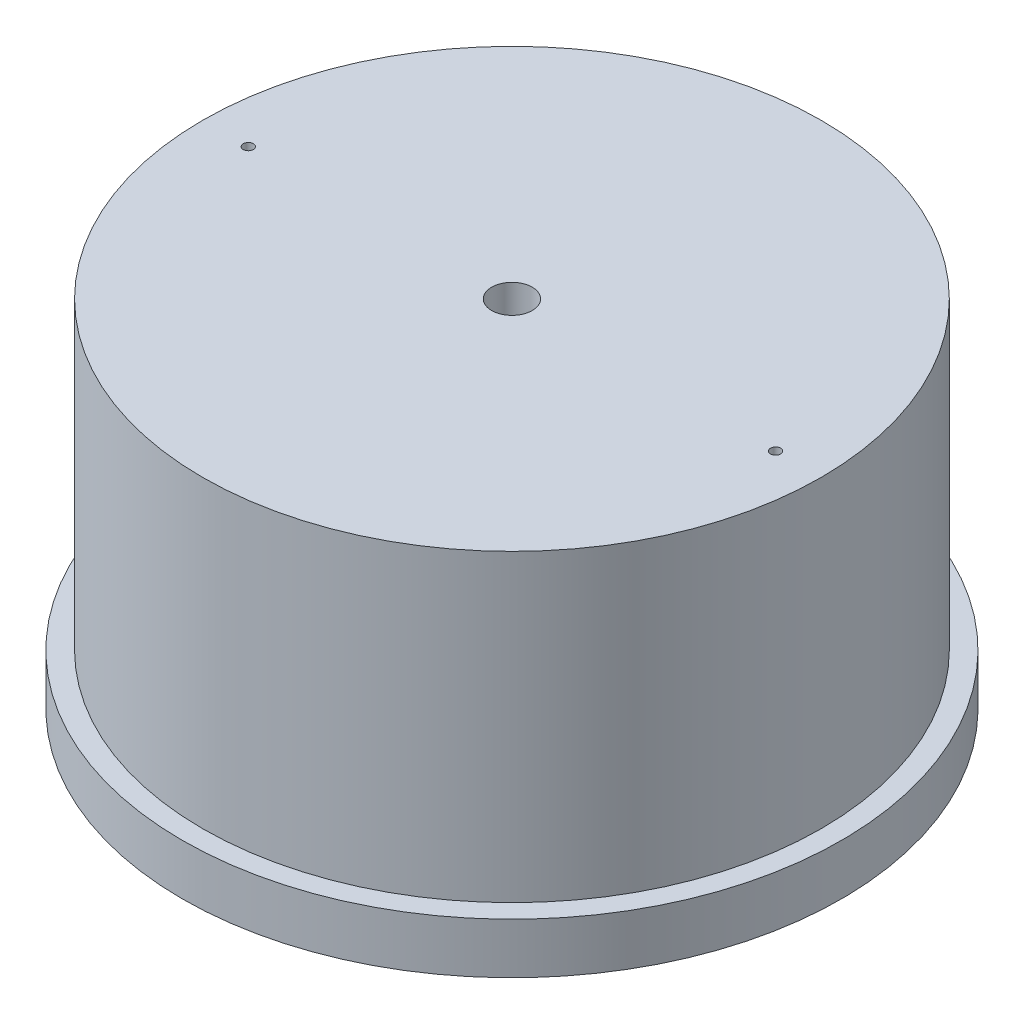
from build123d import *

# Parameters (mm, degrees)
SKETCH1_R           = 32.5
BOSS_EXTRUDE1_DEPTH = 35
CUT_EXTRUDE2_START  = -30
SKETCH2_R           = 32.5
SKETCH2_R_2         = 30.5
CUT_EXTRUDE2_DEPTH  = 30
SKETCH3_R           = 28
SKETCH3_R_2         = 24
CUT_EXTRUDE3_DEPTH  = 25
SKETCH4_R           = 18
CUT_EXTRUDE4_DEPTH  = 20
SKETCH5_R           = 0.5
CUT_EXTRUDE5_DEPTH  = 58.771100041
SKETCH6_R           = 2
CUT_EXTRUDE6_DEPTH  = 58.771100041


with BuildPart() as part:
    # Sketch1 → Boss-Extrude1 (new body)
    with BuildSketch(Plane(origin=(0, 0, 0), x_dir=(1, 0, 0), z_dir=(0, 1, 0))):
        Circle(SKETCH1_R)
    extrude(amount=BOSS_EXTRUDE1_DEPTH)

    # Sketch2 → Cut-Extrude2 (cut)
    with BuildSketch(Plane(origin=(0, 35, 0), x_dir=(1, 0, 0), z_dir=(0, 1, 0)).offset(CUT_EXTRUDE2_START)):
        Circle(SKETCH2_R)
        Circle(SKETCH2_R_2, mode=Mode.SUBTRACT)
    extrude(amount=CUT_EXTRUDE2_DEPTH, mode=Mode.SUBTRACT)

    # Sketch3 → Cut-Extrude3 (cut)
    with BuildSketch(Plane.XZ):
        Circle(SKETCH3_R)
        Circle(SKETCH3_R_2, mode=Mode.SUBTRACT)
    extrude(amount=-CUT_EXTRUDE3_DEPTH, mode=Mode.SUBTRACT)

    # Sketch4 → Cut-Extrude4 (cut)
    with BuildSketch(Plane.XZ):
        Circle(SKETCH4_R)
    extrude(amount=-CUT_EXTRUDE4_DEPTH, mode=Mode.SUBTRACT)

    # Sketch5 → Cut-Extrude5 (cut, through all)
    with BuildSketch(Plane(origin=(0, 35, 0), x_dir=(1, 0, 0), z_dir=(0, 1, 0))):
        with Locations((-26, 0)):
            Circle(SKETCH5_R)
        with Locations((26, 0)):
            Circle(SKETCH5_R)
    extrude(amount=-CUT_EXTRUDE5_DEPTH, mode=Mode.SUBTRACT)

    # Sketch6 → Cut-Extrude6 (cut, through all)
    with BuildSketch(Plane(origin=(0, 35, 0), x_dir=(1, 0, 0), z_dir=(0, 1, 0))):
        Circle(SKETCH6_R)
    extrude(amount=-CUT_EXTRUDE6_DEPTH, mode=Mode.SUBTRACT)


solid = part.part
